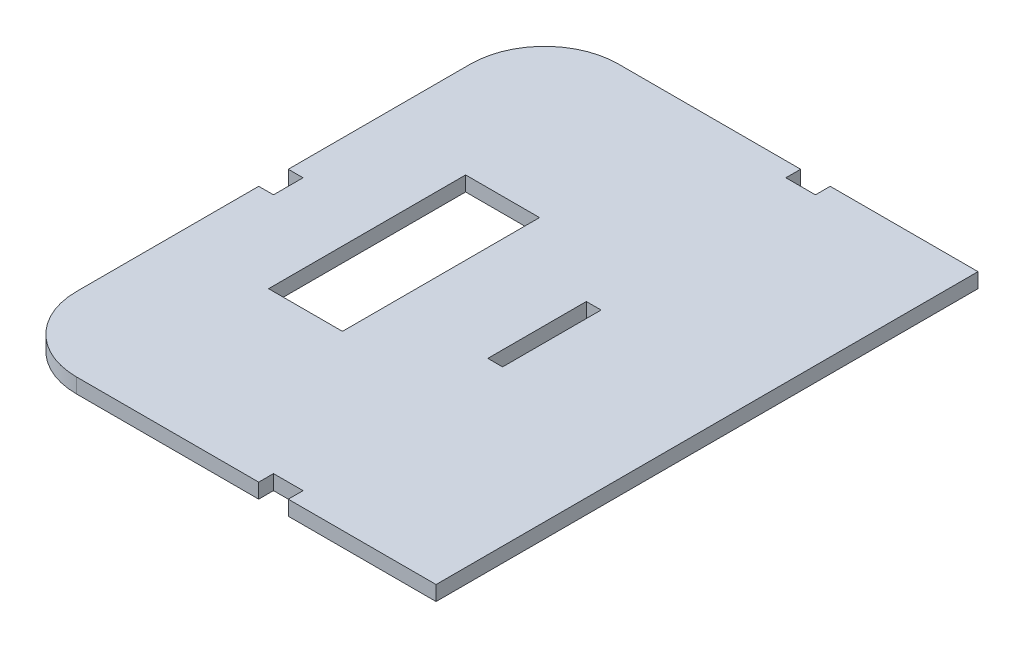
from build123d import *

# Parameters (mm, degrees)
EXTRUDE_3_DEPTH    = 3
SKETCH1_W          = 15
SKETCH1_H          = 40
SKETCH1_W_2        = 3
SKETCH1_H_2        = 20
CUT_EXTRUDE1_DEPTH = 10
FILLET1_R          = 15


with BuildPart() as part:
    # Эскиз4 → Бобышка-Вытянуть3 (new body)
    with BuildSketch(Plane(origin=(0, 0, 0), x_dir=(1, 0, 0), z_dir=(0, 1, 0))):
        Polygon((88, 0), (88, 110), (58, 110), (58, 107), (55, 107), (52, 107), (52, 110), (0, 110), (0, 58), (3, 58), (3, 55), (3, 52), (0, 52), (0, 0), (52, 0), (52, 3), (55, 3), (58, 3), (58, 0), align=None)
    extrude(amount=EXTRUDE_3_DEPTH)

    # Sketch1 → Cut-Extrude1 (cut)
    with BuildSketch(Plane(origin=(0, 3, 0), x_dir=(1, 0, 0), z_dir=(0, 1, 0))):
        with Locations((26.5, 55)):
            Rectangle(SKETCH1_W, SKETCH1_H)
        with Locations((55, 55)):
            Rectangle(SKETCH1_W_2, SKETCH1_H_2)
    extrude(amount=-CUT_EXTRUDE1_DEPTH, mode=Mode.SUBTRACT)

    # Fillet1
    fillet1_edges = [part.edges().sort_by_distance(p)[0] for p in [
        (0, 1.5, 0),
        (0, 1.5, -110),
    ]]
    fillet(fillet1_edges, radius=FILLET1_R)


solid = part.part
